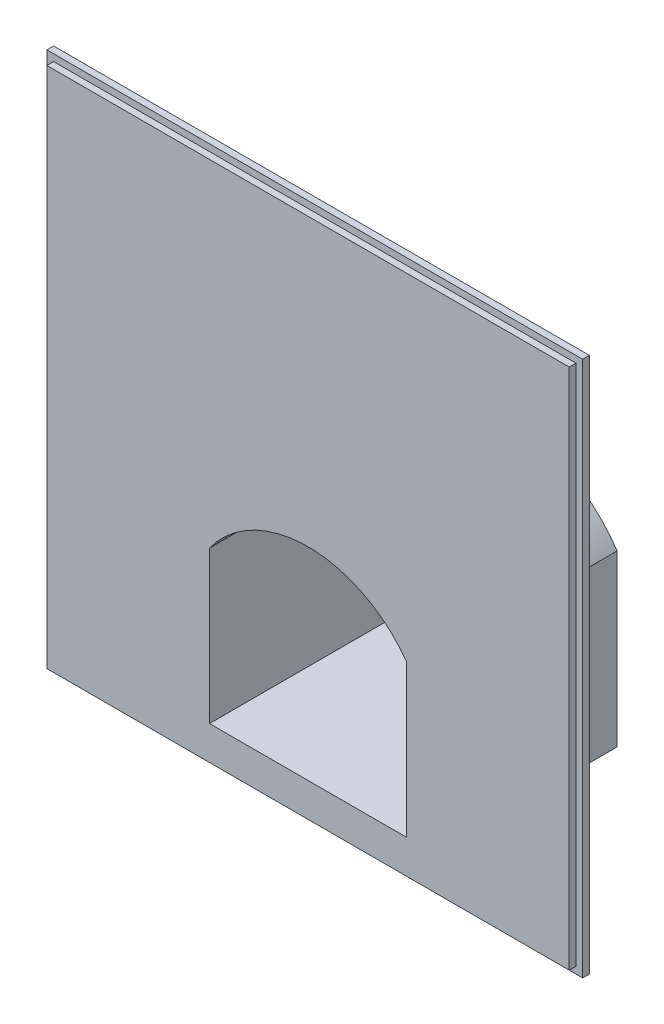
from build123d import *

# Parameters (mm, degrees)
SKETCH1_W           = 39.7
SKETCH1_H           = 39.7
BOSS_EXTRUDE1_DEPTH = 1
BOSS_EXTRUDE2_DEPTH = 13.6
SHELL1_START        = -12.6
SHELL1_DEPTH        = 13.6
SKETCH3_W           = 39.7
SKETCH3_H           = 39.7
SKETCH3_W_2         = 38.7
SKETCH3_H_2         = 38.7
CUT_EXTRUDE1_DEPTH  = 0.5
CUT_EXTRUDE2_REACH  = 33.642
SKETCH4_W           = 2
SKETCH4_H           = 0.3


# Read off the part's stored shape, not the designer's step: Shell1
with BuildPart() as part:
    # Sketch1 → Boss-Extrude1 (new body)
    with BuildSketch(Plane.XY):
        Rectangle(SKETCH1_W, SKETCH1_H)
    extrude(amount=BOSS_EXTRUDE1_DEPTH)

    # Sketch2 → Boss-Extrude2 (add)
    with BuildSketch(Plane(origin=(0, 0, 0), x_dir=(-1, 0, 0), z_dir=(0, 0, -1))):
        with BuildLine():
            Line((-8.3, -17.85), (8.3, -17.85))
            Line((8.3, -17.85), (8.3, -5.272366093))
            ThreePointArc((8.3, -5.272366093), (0, -0.85), (-8.3, -5.272366093))
            Line((-8.3, -5.272366093), (-8.3, -17.85))
        make_face()
    extrude(amount=BOSS_EXTRUDE2_DEPTH)

    # Shell1 outline → Shell1 (cut)
    with BuildSketch(Plane.XY.offset(SHELL1_START)):
        with BuildLine():
            Line((7.3, -16.85), (7.3, -5.585971125))
            ThreePointArc((7.3, -5.585971125), (0, -1.85), (-7.3, -5.585971125))
            Line((-7.3, -5.585971125), (-7.3, -16.85))
            Line((-7.3, -16.85), (7.3, -16.85))
        make_face()
    extrude(amount=SHELL1_DEPTH, mode=Mode.SUBTRACT)

    # Sketch3 → Cut-Extrude1 (cut)
    with BuildSketch(Plane.XY.offset(1)):
        Rectangle(SKETCH3_W, SKETCH3_H)
        Rectangle(SKETCH3_W_2, SKETCH3_H_2, mode=Mode.SUBTRACT)
    extrude(amount=-CUT_EXTRUDE1_DEPTH, mode=Mode.SUBTRACT)

    # Sketch4 → Cut-Extrude2 (cut, up to next)
    with BuildSketch(Plane(origin=(0, 0, -13.6), x_dir=(-1, 0, 0), z_dir=(0, 0, -1)), mode=Mode.PRIVATE) as cut_extrude2_sk1:
        with Locations((-5.5, -15.7)):
            Rectangle(SKETCH4_W, SKETCH4_H)
    cut_extrude2_tool1 = extrude(cut_extrude2_sk1.sketch, amount=-CUT_EXTRUDE2_REACH, mode=Mode.PRIVATE) & part.part
    # Sketch4 → Cut-Extrude2 (cut, up to next)
    with BuildSketch(Plane(origin=(0, 0, -13.6), x_dir=(-1, 0, 0), z_dir=(0, 0, -1)), mode=Mode.PRIVATE) as cut_extrude2_sk2:
        with Locations((5.5, -15.7)):
            Rectangle(SKETCH4_W, SKETCH4_H)
    cut_extrude2_tool2 = extrude(cut_extrude2_sk2.sketch, amount=-CUT_EXTRUDE2_REACH, mode=Mode.PRIVATE) & part.part
    add(cut_extrude2_tool1.solids().sort_by_distance((5.5, -15.7, -13.6))[0], mode=Mode.SUBTRACT)
    add(cut_extrude2_tool2.solids().sort_by_distance((-5.5, -15.7, -13.6))[0], mode=Mode.SUBTRACT)


solid = part.part
